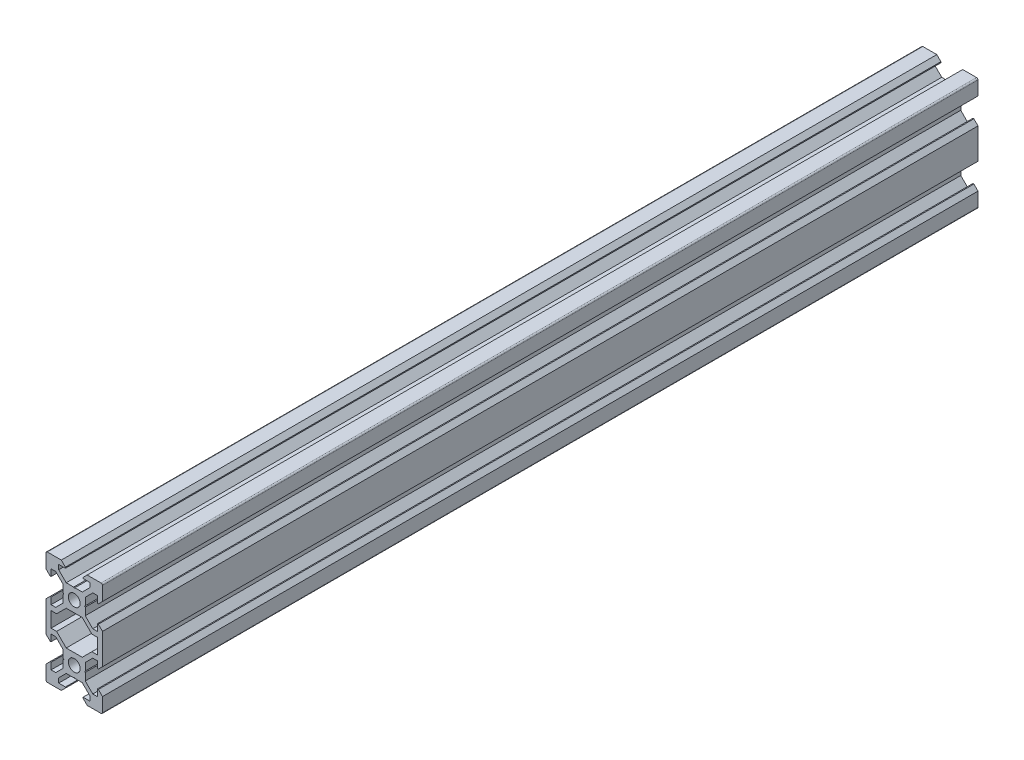
from build123d import *

# Parameters (mm, degrees)
ESBO_O1_R                = 2.1
RESSALTO_EXTRUS_O1_DEPTH = 310


with BuildPart() as part:
    # Esboço1 → Ressalto-extrusão1 (new body)
    with BuildSketch(Plane.XY):
        with BuildLine():
            Line((3.9, 9.79), (3.69, 10))
            Line((3.69, 10), (3.9, 10.21))
            Line((3.9, 10.21), (3.9, 12.839339828))
            Line((3.9, 12.839339828), (6.560660172, 15.5))
            Line((6.560660172, 15.5), (8.2, 15.5))
            Line((8.2, 15.5), (8.2, 13.125))
            Line((8.2, 13.125), (8.545, 13.125))
            Line((8.545, 13.125), (10, 14.58))
            Line((10, 14.58), (10, 19.5))
            ThreePointArc((10, 19.5), (9.853553391, 19.853553391), (9.5, 20))
            Line((9.5, 20), (4.58, 20))
            Line((4.58, 20), (3.125, 18.545))
            Line((3.125, 18.545), (3.125, 18.2))
            Line((3.125, 18.2), (5.5, 18.2))
            Line((5.5, 18.2), (5.5, 16.560660172))
            Line((5.5, 16.560660172), (2.839339828, 13.9))
            Line((2.839339828, 13.9), (0.21, 13.9))
            Line((0.21, 13.9), (0, 13.69))
            Line((0, 13.69), (-0.21, 13.9))
            Line((-0.21, 13.9), (-2.839339828, 13.9))
            Line((-2.839339828, 13.9), (-5.5, 16.560660172))
            Line((-5.5, 16.560660172), (-5.5, 18.2))
            Line((-5.5, 18.2), (-3.125, 18.2))
            Line((-3.125, 18.2), (-3.125, 18.545))
            Line((-3.125, 18.545), (-4.58, 20))
            Line((-4.58, 20), (-9.5, 20))
            ThreePointArc((-9.5, 20), (-9.853553391, 19.853553391), (-10, 19.5))
            Line((-10, 19.5), (-10, 14.58))
            Line((-10, 14.58), (-8.545, 13.125))
            Line((-8.545, 13.125), (-8.2, 13.125))
            Line((-8.2, 13.125), (-8.2, 15.5))
            Line((-8.2, 15.5), (-6.560660172, 15.5))
            Line((-6.560660172, 15.5), (-3.9, 12.839339828))
            Line((-3.9, 12.839339828), (-3.9, 10.21))
            Line((-3.9, 10.21), (-3.69, 10))
            Line((-3.69, 10), (-3.9, 9.79))
            Line((-3.9, 9.79), (-3.9, 7.160660172))
            Line((-3.9, 7.160660172), (-6.560660172, 4.5))
            Line((-6.560660172, 4.5), (-8.2, 4.5))
            Line((-8.2, 4.5), (-8.2, 6.875))
            Line((-8.2, 6.875), (-8.545, 6.875))
            Line((-8.545, 6.875), (-10, 5.42))
            Line((-10, 5.42), (-10, -5.42))
            Line((-10, -5.42), (-8.545, -6.875))
            Line((-8.545, -6.875), (-8.2, -6.875))
            Line((-8.2, -6.875), (-8.2, -4.5))
            Line((-8.2, -4.5), (-6.560660172, -4.5))
            Line((-6.560660172, -4.5), (-3.9, -7.160660172))
            Line((-3.9, -7.160660172), (-3.9, -9.79))
            Line((-3.9, -9.79), (-3.69, -10))
            Line((-3.69, -10), (-3.9, -10.21))
            Line((-3.9, -10.21), (-3.9, -12.839339828))
            Line((-3.9, -12.839339828), (-6.560660172, -15.5))
            Line((-6.560660172, -15.5), (-8.2, -15.5))
            Line((-8.2, -15.5), (-8.2, -13.125))
            Line((-8.2, -13.125), (-8.545, -13.125))
            Line((-8.545, -13.125), (-10, -14.58))
            Line((-10, -14.58), (-10, -19.5))
            ThreePointArc((-10, -19.5), (-9.853553391, -19.853553391), (-9.5, -20))
            Line((-9.5, -20), (-4.58, -20))
            Line((-4.58, -20), (-3.125, -18.545))
            Line((-3.125, -18.545), (-3.125, -18.2))
            Line((-3.125, -18.2), (-5.5, -18.2))
            Line((-5.5, -18.2), (-5.5, -16.560660172))
            Line((-5.5, -16.560660172), (-2.839339828, -13.9))
            Line((-2.839339828, -13.9), (-0.21, -13.9))
            Line((-0.21, -13.9), (0, -13.69))
            Line((0, -13.69), (0.21, -13.9))
            Line((0.21, -13.9), (2.839339828, -13.9))
            Line((2.839339828, -13.9), (5.5, -16.560660172))
            Line((5.5, -16.560660172), (5.5, -18.2))
            Line((5.5, -18.2), (3.125, -18.2))
            Line((3.125, -18.2), (3.125, -18.545))
            Line((3.125, -18.545), (4.58, -20))
            Line((4.58, -20), (9.5, -20))
            ThreePointArc((9.5, -20), (9.853553391, -19.853553391), (10, -19.5))
            Line((10, -19.5), (10, -14.58))
            Line((10, -14.58), (8.545, -13.125))
            Line((8.545, -13.125), (8.2, -13.125))
            Line((8.2, -13.125), (8.2, -15.5))
            Line((8.2, -15.5), (6.560660172, -15.5))
            Line((6.560660172, -15.5), (3.9, -12.839339828))
            Line((3.9, -12.839339828), (3.9, -10.21))
            Line((3.9, -10.21), (3.69, -10))
            Line((3.69, -10), (3.9, -9.79))
            Line((3.9, -9.79), (3.9, -7.160660172))
            Line((3.9, -7.160660172), (6.560660172, -4.5))
            Line((6.560660172, -4.5), (8.2, -4.5))
            Line((8.2, -4.5), (8.2, -6.875))
            Line((8.2, -6.875), (8.545, -6.875))
            Line((8.545, -6.875), (10, -5.42))
            Line((10, -5.42), (10, 5.42))
            Line((10, 5.42), (8.545, 6.875))
            Line((8.545, 6.875), (8.2, 6.875))
            Line((8.2, 6.875), (8.2, 4.5))
            Line((8.2, 4.5), (6.560660172, 4.5))
            Line((6.560660172, 4.5), (3.9, 7.160660172))
            Line((3.9, 7.160660172), (3.9, 9.79))
        make_face()
        with Locations((0, -10)):
            Circle(ESBO_O1_R, mode=Mode.SUBTRACT)
        with Locations((0, 10)):
            Circle(ESBO_O1_R, mode=Mode.SUBTRACT)
        Polygon((8.2, -2.7), (8.2, 2.7), (6.239339828, 2.7), (2.839339828, 6.1), (-2.839339828, 6.1), (-6.239339828, 2.7), (-8.2, 2.7), (-8.2, -2.7), (-6.239339828, -2.7), (-2.839339828, -6.1), (2.839339828, -6.1), (6.239339828, -2.7), align=None, mode=Mode.SUBTRACT)
    extrude(amount=RESSALTO_EXTRUS_O1_DEPTH)


solid = part.part
